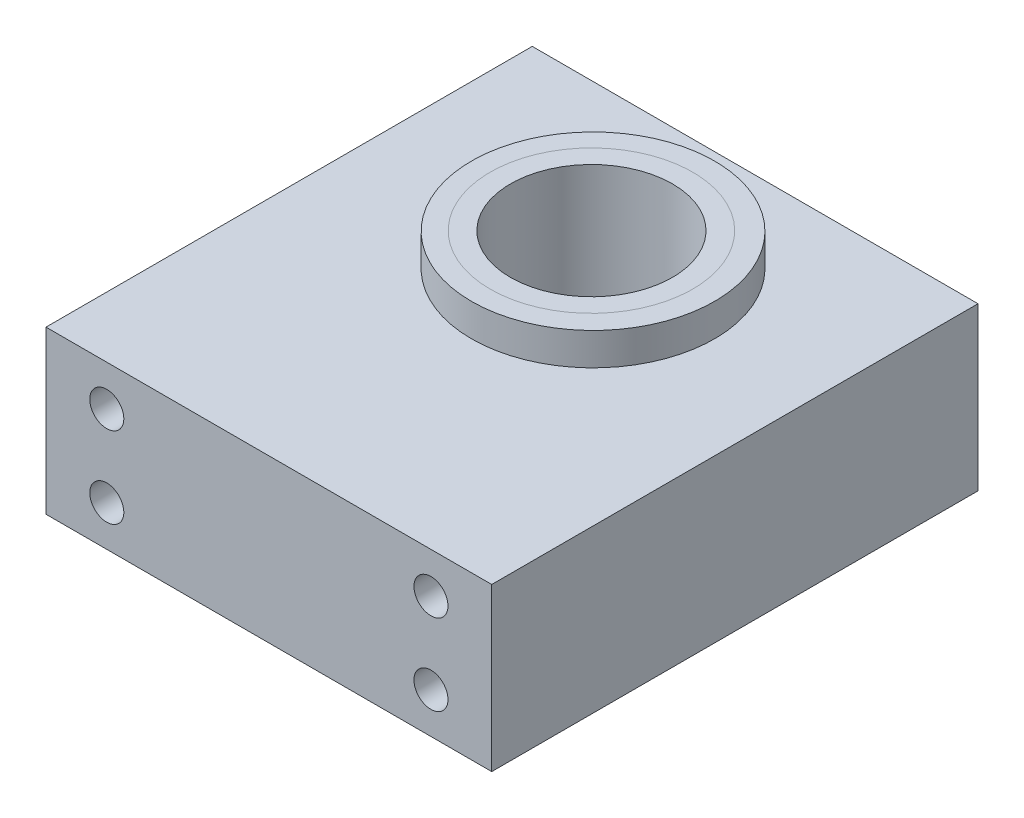
from build123d import *

# Parameters (mm, degrees)
SKETCH1_W                                     = 110
SKETCH1_H                                     = 120
GUIDE_BLOCK_DEPTH                             = 40
SKETCH2_R                                     = 30
SKETCH2_R_2                                   = 25
BUSH_BOSS_DEPTH                               = 8
SKETCH3_R                                     = 25
CUT_EXTRUDE1_DEPTH                            = 106
SKETCH8_R                                     = 25
SKETCH8_R_2                                   = 20
BOSS_EXTRUDE3_DEPTH                           = 48
CBORE_START                                   = -40
CBORE_FOR_M8_HEX_SOCKET_HEAD_CAP_SCR_2_R      = 4.2
CBORE_FOR_M8_HEX_SOCKET_HEAD_CAP_SCREW1_DEPTH = 120
CBORE_FOR_M8_HEX_SOCKET_HEAD_CAP_SCR_3_O_R    = 7.5
CBORE_FOR_M8_HEX_SOCKET_HEAD_CAP_SCR_3_O_R_2  = 4.2
CBORE_FOR_M8_HEX_SOCKET_HEAD_CAP_SCR_3_DEPTH  = 8.6


# Read off the part's stored shape, not the designer's step: M6 Tapped Hole1, CBORE for M8 Hex Socket Head Cap Screw1
with BuildPart() as part:
    # Sketch1 → GUIDE_BLOCK (new body)
    with BuildSketch(Plane(origin=(0, 0, 0), x_dir=(1, 0, 0), z_dir=(0, 1, 0))):
        with Locations((0, -20)):
            Rectangle(SKETCH1_W, SKETCH1_H)
    extrude(amount=GUIDE_BLOCK_DEPTH)

    # Sketch2 → BUSH_BOSS (add)
    with BuildSketch(Plane(origin=(0, 40, 0), x_dir=(1, 0, 0), z_dir=(0, 1, 0))):
        with Locations(Location((0, 0, 0), (0, 0, 270))):
            Circle(SKETCH2_R)
        with Locations(Location((-0.316230532, -0.07747648, 0), (0, 0, 270))):
            Circle(SKETCH2_R_2, mode=Mode.SUBTRACT)
    extrude(amount=BUSH_BOSS_DEPTH)

    # Sketch3 → Cut-Extrude1 (cut, through all)
    with BuildSketch(Plane(origin=(0, 40, 0), x_dir=(1, 0, 0), z_dir=(0, 1, 0))):
        with Locations(Location((-0.316230532, -0.07747648, 0), (0, 0, 270))):
            Circle(SKETCH3_R)
    extrude(amount=-CUT_EXTRUDE1_DEPTH, mode=Mode.SUBTRACT)


with BuildPart() as body_2:
    # Sketch8 → Boss-Extrude3 (new body)
    with BuildSketch(Plane(origin=(0, 0, 0), x_dir=(1, 0, 0), z_dir=(0, 1, 0))):
        with Locations(Location((-0.316230532, -0.07747648, 0), (0, 0, 270))):
            Circle(SKETCH8_R)
        with Locations(Location((-0.316230532, -0.07747648, 0), (0, 0, 270))):
            Circle(SKETCH8_R_2, mode=Mode.SUBTRACT)
    extrude(amount=BOSS_EXTRUDE3_DEPTH)


with BuildPart() as m6_tapped_hole1_tool:
    # M6 Tapped Hole1 outline → M6 Tapped Hole1 (revolve)
    with BuildSketch(Plane.XZ.offset(-20)):
        Polygon((2.5, -19.723195432), (0, -19.723195432), (0, -40), (3, -40), (3, -28), (2.5, -28), align=None)
    revolve(axis=Axis((0, 20, 0), (0, 0, 1)))


with BuildPart() as part_1:
    add(part.part)

    # M6 Tapped Hole1: cut by m6_tapped_hole1_tool
    add(m6_tapped_hole1_tool.part, mode=Mode.SUBTRACT)

    # CBORE for M8 Hex Socket Head Cap Scr 2 → CBORE for M8 Hex Socket Head Cap Screw1 (cut)
    with BuildSketch(Plane.XY.offset(CBORE_START)):
        with Locations((-40, 10)):
            Circle(CBORE_FOR_M8_HEX_SOCKET_HEAD_CAP_SCR_2_R)
        with Locations((40, 30)):
            Circle(CBORE_FOR_M8_HEX_SOCKET_HEAD_CAP_SCR_2_R)
        with Locations((-40, 30)):
            Circle(CBORE_FOR_M8_HEX_SOCKET_HEAD_CAP_SCR_2_R)
        with Locations((40, 10)):
            Circle(CBORE_FOR_M8_HEX_SOCKET_HEAD_CAP_SCR_2_R)
    extrude(amount=CBORE_FOR_M8_HEX_SOCKET_HEAD_CAP_SCREW1_DEPTH, mode=Mode.SUBTRACT)

    # CBORE for M8 Hex Socket Head Cap Scr 3 o → CBORE for M8 Hex Socket Head Cap Scr 3 (cut)
    # profile 1 of 4: a face of its own
    with BuildSketch(Plane.XY.offset(CBORE_START)):
        with Locations((-40, 10)):
            Circle(CBORE_FOR_M8_HEX_SOCKET_HEAD_CAP_SCR_3_O_R)
        with Locations((-40, 10)):
            Circle(CBORE_FOR_M8_HEX_SOCKET_HEAD_CAP_SCR_3_O_R_2, mode=Mode.SUBTRACT)
    # profile 2 of 4: a face of its own
    with BuildSketch(Plane.XY.offset(CBORE_START)):
        with Locations((40, 30)):
            Circle(CBORE_FOR_M8_HEX_SOCKET_HEAD_CAP_SCR_3_O_R)
        with Locations((40, 30)):
            Circle(CBORE_FOR_M8_HEX_SOCKET_HEAD_CAP_SCR_3_O_R_2, mode=Mode.SUBTRACT)
    # profile 3 of 4: a face of its own
    with BuildSketch(Plane.XY.offset(CBORE_START)):
        with Locations((-40, 30)):
            Circle(CBORE_FOR_M8_HEX_SOCKET_HEAD_CAP_SCR_3_O_R)
        with Locations((-40, 30)):
            Circle(CBORE_FOR_M8_HEX_SOCKET_HEAD_CAP_SCR_3_O_R_2, mode=Mode.SUBTRACT)
    # profile 4 of 4: a face of its own
    with BuildSketch(Plane.XY.offset(CBORE_START)):
        with Locations((40, 10)):
            Circle(CBORE_FOR_M8_HEX_SOCKET_HEAD_CAP_SCR_3_O_R)
        with Locations((40, 10)):
            Circle(CBORE_FOR_M8_HEX_SOCKET_HEAD_CAP_SCR_3_O_R_2, mode=Mode.SUBTRACT)
    extrude(amount=CBORE_FOR_M8_HEX_SOCKET_HEAD_CAP_SCR_3_DEPTH, mode=Mode.SUBTRACT)


with BuildPart() as body_2_1:
    add(body_2.part)

    # M6 Tapped Hole1: cut by m6_tapped_hole1_tool
    add(m6_tapped_hole1_tool.part, mode=Mode.SUBTRACT)


solid = Compound([part_1.part, body_2_1.part])
